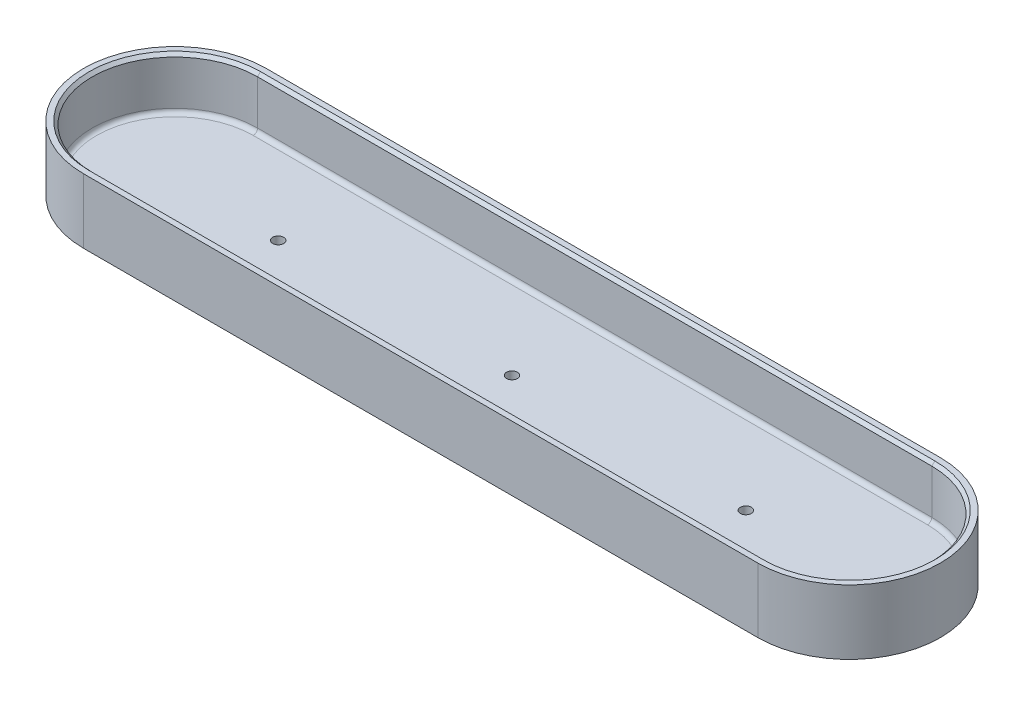
from build123d import *

# Parameters (mm, degrees)
MAINBLOCK_DEPTH     = 3.81
BOSS_EXTRUDE1_DEPTH = 19.05
SKETCH3_R           = 1.6129
CUT_EXTRUDE1_DEPTH  = 131.598305889
FILLET1_R           = 1.27
CHAMFER1_SIZE       = 0.889


with BuildPart() as part:
    # Sketch1 → MainBlock (new body)
    with BuildSketch(Plane(origin=(0, 0, 0), x_dir=(1, 0, 0), z_dir=(0, 1, 0))):
        with BuildLine():
            Line((-99.441, 24.384), (99.441, 24.384))
            ThreePointArc((99.441, 24.384), (123.825, 0), (99.441, -24.384))
            Line((99.441, -24.384), (-99.441, -24.384))
            ThreePointArc((-99.441, -24.384), (-123.825, 0), (-99.441, 24.384))
        make_face()
    extrude(amount=MAINBLOCK_DEPTH)

    # Sketch2 → Boss-Extrude1 (add)
    with BuildSketch(Plane.XZ):
        with BuildLine():
            Line((-99.441, 26.924), (99.441, 26.924))
            ThreePointArc((99.441, 26.924), (126.365, 0), (99.441, -26.924))
            Line((99.441, -26.924), (-99.441, -26.924))
            ThreePointArc((-99.441, -26.924), (-126.365, 0), (-99.441, 26.924))
        make_face()
        with BuildLine():
            Line((99.441, 24.384), (-99.441, 24.384))
            ThreePointArc((-99.441, 24.384), (-123.825, 0), (-99.441, -24.384))
            Line((-99.441, -24.384), (99.441, -24.384))
            ThreePointArc((99.441, -24.384), (123.825, 0), (99.441, 24.384))
        make_face(mode=Mode.SUBTRACT)
    extrude(amount=-BOSS_EXTRUDE1_DEPTH)

    # Sketch3 → Cut-Extrude1 (cut, through all)
    with BuildSketch(Plane.XZ):
        Circle(SKETCH3_R)
        with Locations((-68.961, 0)):
            Circle(SKETCH3_R)
        with Locations((68.961, 0)):
            Circle(SKETCH3_R)
    extrude(amount=-CUT_EXTRUDE1_DEPTH, mode=Mode.SUBTRACT)

    # Fillet1
    fillet1_edges = [part.edges().sort_by_distance(p)[0] for p in [
        (123.825, 3.81, 0),
        (0, 3.81, 24.384),
        (-123.825, 3.81, 0),
        (0, 3.81, -24.384),
    ]]
    fillet(fillet1_edges, radius=FILLET1_R)

    # Chamfer1
    chamfer1_edges = [part.edges().sort_by_distance(p)[0] for p in [
        (0, 19.05, 24.384),
        (-123.825, 19.05, 0),
        (123.825, 19.05, 0),
        (0, 19.05, -24.384),
    ]]
    chamfer(chamfer1_edges, length=CHAMFER1_SIZE)


solid = part.part
